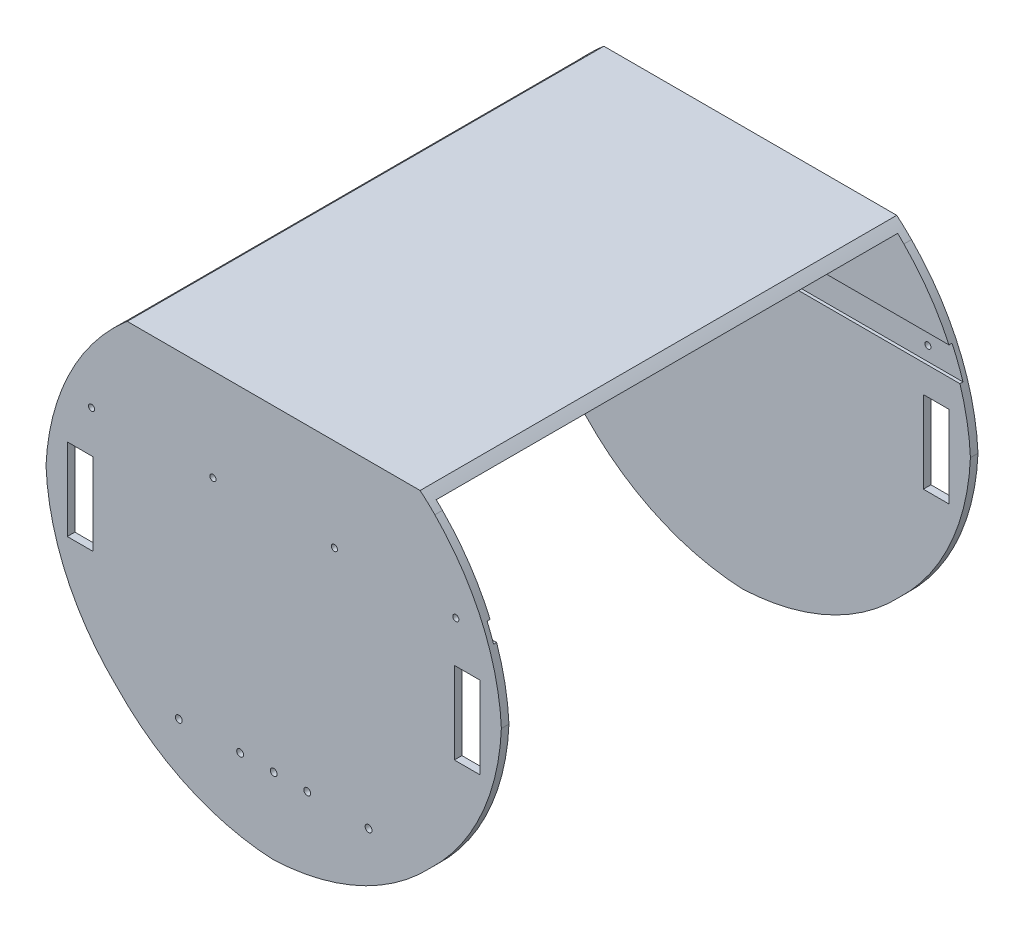
from build123d import *

# Parameters (mm, degrees)
BOSS_EXTRUDE1_DEPTH      = 150
BOSS_EXTRUDE1_DEPTH_BACK = 150
CUT_EXTRUDE1_DEPTH       = 338.979289306
CUT_EXTRUDE1_DEPTH_BACK  = 338.979289306
SKETCH2_OUTSIDE_W        = 403.13
SKETCH2_OUTSIDE_H        = 362.13
CUT_EXTRUDE2_DEPTH       = 338.979289306
CUT_EXTRUDE2_DEPTH_BACK  = 338.979289306
SKETCH3_W                = 4
SKETCH3_H                = 11
SKETCH3_H_2              = 18.5
CUT_EXTRUDE3_DEPTH       = 338.979289306
CUT_EXTRUDE3_DEPTH_BACK  = 338.979289306
SKETCH4_R                = 2
CUT_EXTRUDE4_DEPTH       = 338.979289306
CUT_EXTRUDE4_DEPTH_BACK  = 338.979289306
SKETCH6_W                = 17
SKETCH6_H                = 54
CUT_EXTRUDE5_REACH       = 435.794
SKETCH7_R                = 2.25


with BuildPart() as part:
    # Sketch1 → Boss-Extrude1 (new, two sides: drawn at the far end of the back side and taken through both)
    with BuildSketch(Plane(origin=(0, 0, 0), x_dir=(0, 0, -1), z_dir=(1, 0, 0)).offset(-BOSS_EXTRUDE1_DEPTH_BACK)):
        Polygon((-152, 0), (-152, 254), (152, 254), (152, 0), (157, 0), (157, 259), (-157, 259), (-157, 0), align=None)
    extrude(amount=BOSS_EXTRUDE1_DEPTH + BOSS_EXTRUDE1_DEPTH_BACK)

    # Sketch2 outside → Cut-Extrude1 (cut, two sides: drawn at the far end of the back side and taken through both)
    with BuildSketch(Plane.XY.offset(-CUT_EXTRUDE1_DEPTH_BACK)):
        with Locations((0, 129.5)):
            Rectangle(SKETCH2_OUTSIDE_W, SKETCH2_OUTSIDE_H)
        with BuildLine():
            ThreePointArc((-106.180566109, 249.989548857), (-57.545132629, 283.138396945), (0, 295.5))
            ThreePointArc((0, 295.5), (57.545132629, 283.138396945), (106.180566109, 249.989548857))
            ThreePointArc((106.180566109, 249.989548857), (137.347558964, 204.051684319), (150, 150))
            ThreePointArc((150, 150), (136.604447301, 93.873050207), (103.124452968, 46.875547032))
            ThreePointArc((103.124452968, 46.875547032), (56.126949793, 13.395552699), (0, 0))
            ThreePointArc((0, 0), (-56.126949793, 13.395552699), (-103.124452968, 46.875547032))
            ThreePointArc((-103.124452968, 46.875547032), (-136.604447301, 93.873050207), (-150, 150))
            ThreePointArc((-150, 150), (-137.347558964, 204.051684319), (-106.180566109, 249.989548857))
        make_face(mode=Mode.SUBTRACT)
    extrude(amount=CUT_EXTRUDE1_DEPTH + CUT_EXTRUDE1_DEPTH_BACK, mode=Mode.SUBTRACT)

    # Sketch3 → Cut-Extrude2 (cut, two sides: drawn at the far end of the back side and taken through both)
    with BuildSketch(Plane(origin=(0, 0, 0), x_dir=(0, 0, -1), z_dir=(1, 0, 0)).offset(-CUT_EXTRUDE2_DEPTH_BACK)):
        with Locations((-152, 198)):
            Rectangle(SKETCH3_W, SKETCH3_H)
        with Locations((152, 198)):
            Rectangle(SKETCH3_W, SKETCH3_H_2)
    extrude(amount=CUT_EXTRUDE2_DEPTH + CUT_EXTRUDE2_DEPTH_BACK, mode=Mode.SUBTRACT)

    # Sketch4 → Cut-Extrude3 (cut, two sides: drawn at the far end of the back side and taken through both)
    with BuildSketch(Plane.XY.offset(-CUT_EXTRUDE3_DEPTH_BACK)):
        with Locations((-120, 198)):
            Circle(SKETCH4_R)
        with Locations((120, 198)):
            Circle(SKETCH4_R)
        with Locations((40, 198)):
            Circle(SKETCH4_R)
        with Locations((-40, 198)):
            Circle(SKETCH4_R)
    extrude(amount=CUT_EXTRUDE3_DEPTH + CUT_EXTRUDE3_DEPTH_BACK, mode=Mode.SUBTRACT)

    # Sketch6 → Cut-Extrude4 (cut, two sides: drawn at the far end of the back side and taken through both)
    with BuildSketch(Plane.XY.offset(-CUT_EXTRUDE4_DEPTH_BACK)):
        with Locations((-127.5, 143.5)):
            Rectangle(SKETCH6_W, SKETCH6_H)
        with Locations((127.5, 143.5)):
            Rectangle(SKETCH6_W, SKETCH6_H)
    extrude(amount=CUT_EXTRUDE4_DEPTH + CUT_EXTRUDE4_DEPTH_BACK, mode=Mode.SUBTRACT)

    # Sketch7 → Cut-Extrude5 (cut, up to next)
    with BuildSketch(Plane.XY.offset(157), mode=Mode.PRIVATE) as cut_extrude5_sk1:
        with Locations((0, 50)):
            Circle(SKETCH7_R)
    cut_extrude5_tool1 = extrude(cut_extrude5_sk1.sketch, amount=-CUT_EXTRUDE5_REACH, mode=Mode.PRIVATE) & part.part
    # Sketch7 → Cut-Extrude5 (cut, up to next)
    with BuildSketch(Plane.XY.offset(157), mode=Mode.PRIVATE) as cut_extrude5_sk2:
        with Locations((22.11, 50)):
            Circle(SKETCH7_R)
    cut_extrude5_tool2 = extrude(cut_extrude5_sk2.sketch, amount=-CUT_EXTRUDE5_REACH, mode=Mode.PRIVATE) & part.part
    # Sketch7 → Cut-Extrude5 (cut, up to next)
    with BuildSketch(Plane.XY.offset(157), mode=Mode.PRIVATE) as cut_extrude5_sk3:
        with Locations((-22.11, 50)):
            Circle(SKETCH7_R)
    cut_extrude5_tool3 = extrude(cut_extrude5_sk3.sketch, amount=-CUT_EXTRUDE5_REACH, mode=Mode.PRIVATE) & part.part
    # Sketch7 → Cut-Extrude5 (cut, up to next)
    with BuildSketch(Plane.XY.offset(157), mode=Mode.PRIVATE) as cut_extrude5_sk4:
        with Locations((-62.5, 49.15)):
            Circle(SKETCH7_R)
    cut_extrude5_tool4 = extrude(cut_extrude5_sk4.sketch, amount=-CUT_EXTRUDE5_REACH, mode=Mode.PRIVATE) & part.part
    # Sketch7 → Cut-Extrude5 (cut, up to next)
    with BuildSketch(Plane.XY.offset(157), mode=Mode.PRIVATE) as cut_extrude5_sk5:
        with Locations((62.5, 49.15)):
            Circle(SKETCH7_R)
    cut_extrude5_tool5 = extrude(cut_extrude5_sk5.sketch, amount=-CUT_EXTRUDE5_REACH, mode=Mode.PRIVATE) & part.part
    add(cut_extrude5_tool1.solids().sort_by_distance((0, 50, 157))[0], mode=Mode.SUBTRACT)
    add(cut_extrude5_tool2.solids().sort_by_distance((22.11, 50, 157))[0], mode=Mode.SUBTRACT)
    add(cut_extrude5_tool3.solids().sort_by_distance((-22.11, 50, 157))[0], mode=Mode.SUBTRACT)
    add(cut_extrude5_tool4.solids().sort_by_distance((-62.5, 49.15, 157))[0], mode=Mode.SUBTRACT)
    add(cut_extrude5_tool5.solids().sort_by_distance((62.5, 49.15, 157))[0], mode=Mode.SUBTRACT)


solid = part.part
